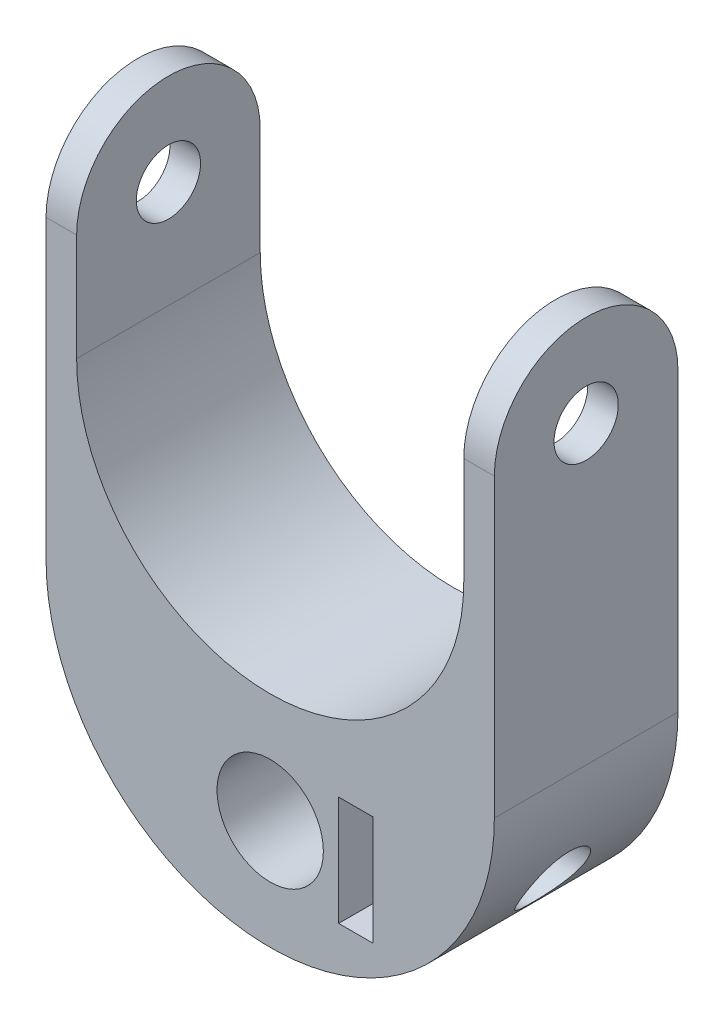
from build123d import *

# Parameters (mm, degrees)
SKETCH1_R               = 3.475
BOSS_EXTRUDE1_DEPTH     = 12
CUT_EXTRUDE3_START      = -29.3
CUT_EXTRUDE3_OUTLINE_R  = 2.1
CUT_EXTRUDE3_DEPTH      = 29.3
SKETCH3_W               = 2.25
SKETCH3_H               = 7.15
CUT_EXTRUDE4_DEPTH      = 9.5
CUT_EXTRUDE6_DEPTH      = 7.2
CUT_EXTRUDE6_DEPTH_BACK = 11.2
SKETCH4_R               = 2.125


# Read off the part's stored shape, not the designer's step: Cut-Extrude3
with BuildPart() as part:
    # Sketch1 → Boss-Extrude1 (new body)
    with BuildSketch(Plane.XY):
        with BuildLine():
            Line((-14.65, 20), (-14.65, -5.35))
            ThreePointArc((-14.65, -5.35), (0, -20), (14.65, -5.35))
            Line((14.65, -5.35), (14.65, 20))
            Line((14.65, 20), (12.65, 20))
            Line((12.65, 20), (12.65, 7.005))
            ThreePointArc((12.65, 7.005), (0, -5.645), (-12.65, 7.005))
            Line((-12.65, 7.005), (-12.65, 20))
            Line((-12.65, 20), (-14.65, 20))
        make_face()
        with Locations((0, -12.825)):
            Circle(SKETCH1_R, mode=Mode.SUBTRACT)
    extrude(amount=BOSS_EXTRUDE1_DEPTH)

    # Cut-Extrude3 outline → Cut-Extrude3 (cut)
    with BuildSketch(Plane.ZY.offset(14.65).offset(CUT_EXTRUDE3_START)):
        with BuildLine():
            ThreePointArc((0, 14), (1.757359313, 18.242640687), (6, 20))
            Line((6, 20), (0, 20))
            Line((0, 20), (0, 14))
        make_face()
        with BuildLine():
            ThreePointArc((6, 20), (10.242640687, 18.242640687), (12, 14))
            Line((12, 14), (12, 20))
            Line((12, 20), (6, 20))
        make_face()
        with Locations((6, 14)):
            Circle(CUT_EXTRUDE3_OUTLINE_R)
    extrude(amount=CUT_EXTRUDE3_DEPTH, mode=Mode.SUBTRACT)

    # Sketch3 → Cut-Extrude4 (cut)
    with BuildSketch(Plane.XY.offset(12)):
        with Locations((5.6, -12.825)):
            Rectangle(SKETCH3_W, SKETCH3_H)
    extrude(amount=-CUT_EXTRUDE4_DEPTH, mode=Mode.SUBTRACT)

    # Sketch4 → Cut-Extrude6 (cut, two sides: drawn at the far end of the back side and taken through both)
    with BuildSketch(Plane.ZY.offset(-6.725).offset(-CUT_EXTRUDE6_DEPTH_BACK)):
        with Locations(Location((6.075, -12.825, 0), (0, 0, 90))):
            Circle(SKETCH4_R)
    extrude(amount=CUT_EXTRUDE6_DEPTH + CUT_EXTRUDE6_DEPTH_BACK, mode=Mode.SUBTRACT)


solid = part.part
